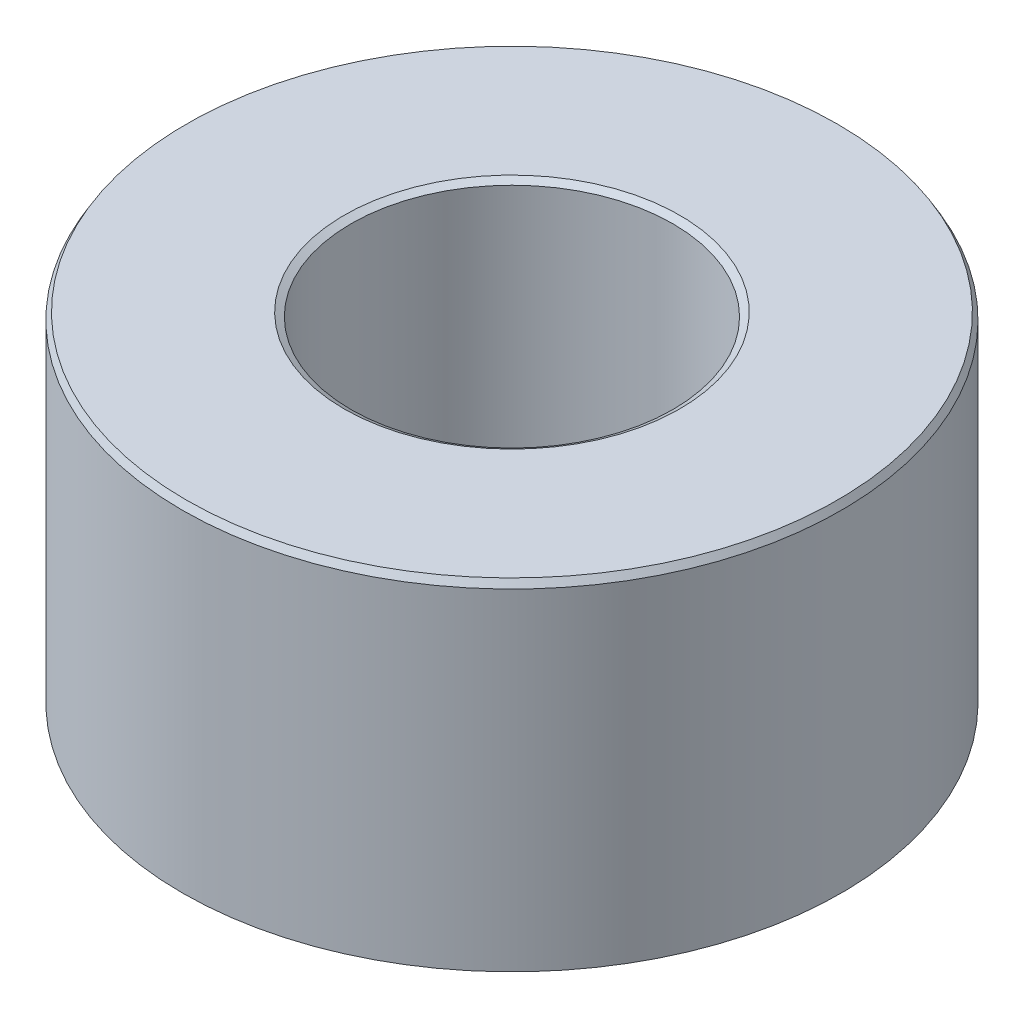
from build123d import *
from OCP.BRepFilletAPI import BRepFilletAPI_MakeChamfer

# Parameters (mm, degrees)
SKETCH1_R           = 45
BOSS_EXTRUDE1_DEPTH = 46.73502754
SKETCH2_R           = 21.978687627
CUT_EXTRUDE1_DEPTH  = 79.956714719
CHAMFER1_SIZE       = 0.934664998
CHAMFER1_SIZE2      = 0.539629088


with BuildPart() as part:
    # Sketch1 → Boss-Extrude1 (new body)
    with BuildSketch(Plane(origin=(0, 0, 0), x_dir=(1, 0, 0), z_dir=(0, 1, 0))):
        Circle(SKETCH1_R)
    extrude(amount=BOSS_EXTRUDE1_DEPTH)

    # Sketch2 → Cut-Extrude1 (cut, through all)
    with BuildSketch(Plane(origin=(0, 0, 0), x_dir=(1, 0, 0), z_dir=(0, 1, 0))):
        Circle(SKETCH2_R)
    extrude(amount=CUT_EXTRUDE1_DEPTH, mode=Mode.SUBTRACT)

    # Chamfer1: one chamfer whose edges measure the first distance from different faces: ONE call of the kernel's chamfer builder (chamfer() names one face for all edges)
    chamfer1_edges_1 = [part.edges().sort_by_distance(p)[0] for p in [
        (-21.978687627, 46.73502754, 0),
    ]]
    chamfer1_side_1 = [part.faces().sort_by_distance(p)[0] for p in [
        (-43.727207794, 46.73502754, 0),
    ]]
    chamfer1_edges_2 = [part.edges().sort_by_distance(p)[0] for p in [
        (-21.978687627, 0, 0),
    ]]
    chamfer1_side_2 = [part.faces().sort_by_distance(p)[0] for p in [
        (-21.978687627, 23.36751377, 0),
    ]]
    chamfer1_edges_3 = [part.edges().sort_by_distance(p)[0] for p in [
        (-45, 0, 0),
    ]]
    chamfer1_side_3 = [part.faces().sort_by_distance(p)[0] for p in [
        (-43.727207794, 0, 0),
    ]]
    chamfer1_edges_4 = [part.edges().sort_by_distance(p)[0] for p in [
        (-45, 46.73502754, 0),
    ]]
    chamfer1_side_4 = [part.faces().sort_by_distance(p)[0] for p in [
        (-45, 23.36751377, 0),
    ]]
    chamfer1 = BRepFilletAPI_MakeChamfer(part.part.solid().wrapped)
    for e in chamfer1_edges_1:
        chamfer1.Add(CHAMFER1_SIZE, CHAMFER1_SIZE2, e.wrapped, chamfer1_side_1[0].wrapped)  # the first distance lies on this face
    for e in chamfer1_edges_2:
        chamfer1.Add(CHAMFER1_SIZE, CHAMFER1_SIZE2, e.wrapped, chamfer1_side_2[0].wrapped)  # the first distance lies on this face
    for e in chamfer1_edges_3:
        chamfer1.Add(CHAMFER1_SIZE, CHAMFER1_SIZE2, e.wrapped, chamfer1_side_3[0].wrapped)  # the first distance lies on this face
    for e in chamfer1_edges_4:
        chamfer1.Add(CHAMFER1_SIZE, CHAMFER1_SIZE2, e.wrapped, chamfer1_side_4[0].wrapped)  # the first distance lies on this face
    add(Compound.cast(chamfer1.Shape()), mode=Mode.REPLACE)


solid = part.part
